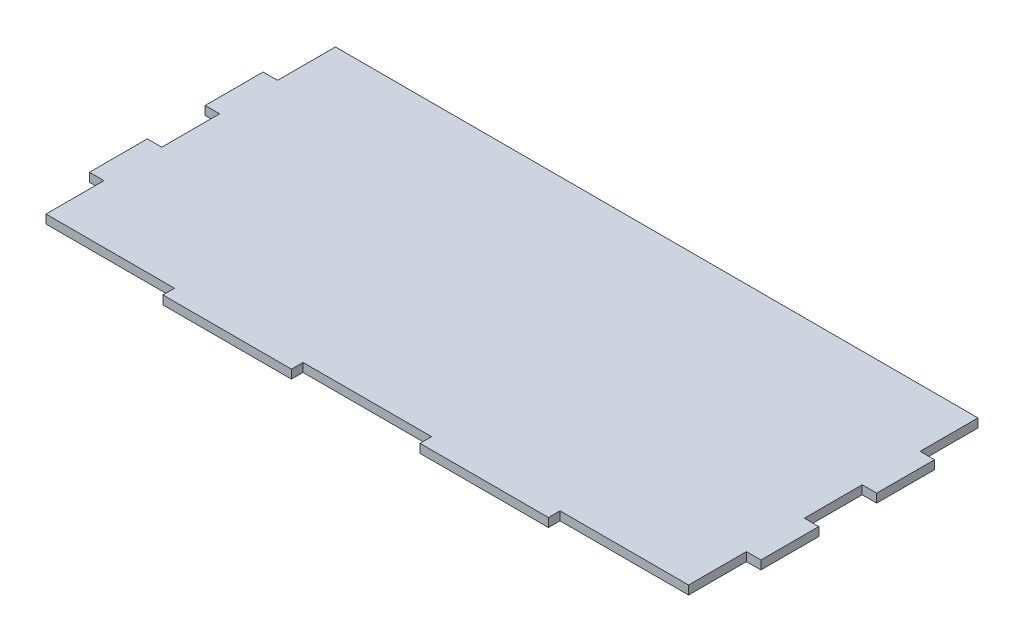
from build123d import *

# Parameters (mm, degrees)
BOSS_EXTRUDE1_DEPTH = 3


with BuildPart() as part:
    # Sketch1 → Boss-Extrude1 (new body)
    with BuildSketch(Plane(origin=(0, 0, 0), x_dir=(1, 0, 0), z_dir=(0, 1, 0))):
        Polygon((-111, 30), (-116, 30), (-116, 10), (-111, 10), (-111, -10), (-116, -10), (-116, -30), (-111, -30), (-111, -50), (-66.6, -50), (-66.6, -54), (-22.2, -54), (-22.2, -50), (22.2, -50), (22.2, -54), (66.6, -54), (66.6, -50), (111, -50), (111, -30), (116, -30), (116, -10), (111, -10), (111, 10), (116, 10), (116, 30), (111, 30), (111, 50), (-111, 50), align=None)
    extrude(amount=BOSS_EXTRUDE1_DEPTH)


solid = part.part
